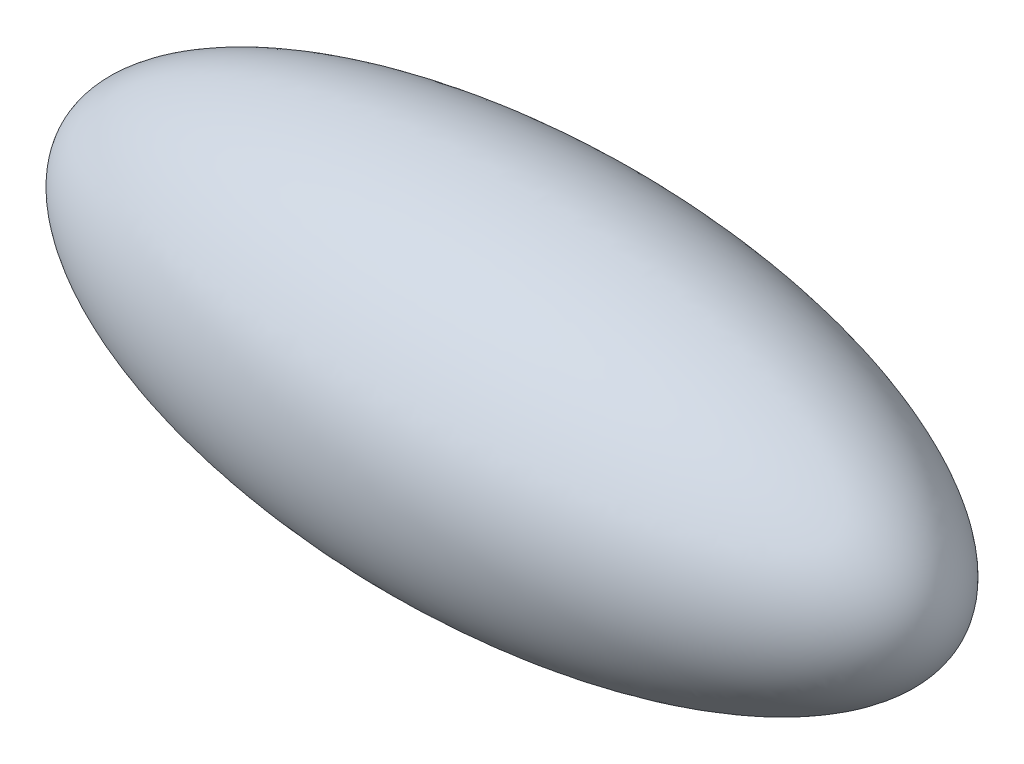
from build123d import *


with BuildPart() as part:
    # Sketch2 → Revolve2 (revolve)
    with BuildSketch(Plane(origin=(0, 0, 0), x_dir=(1, 0, 0), z_dir=(0, 1, 0))):
        with BuildLine():
            Line((0.5, 0), (-0.5, 0))
            add(Edge.make_bspline(
                [(-0.5, 0), (-0.5, -0.2), (0, -0.2), (0.5, -0.2), (0.5, 0)],
                knots=[0, 0, 0, 1.570796327, 1.570796327, 3.141592654, 3.141592654, 3.141592654], degree=2, weights=[1, 0.707106781, 1, 0.707106781, 1]))
        make_face()
    revolve(axis=Axis((-0.5, 0, 0), (1, 0, 0)))


solid = part.part
